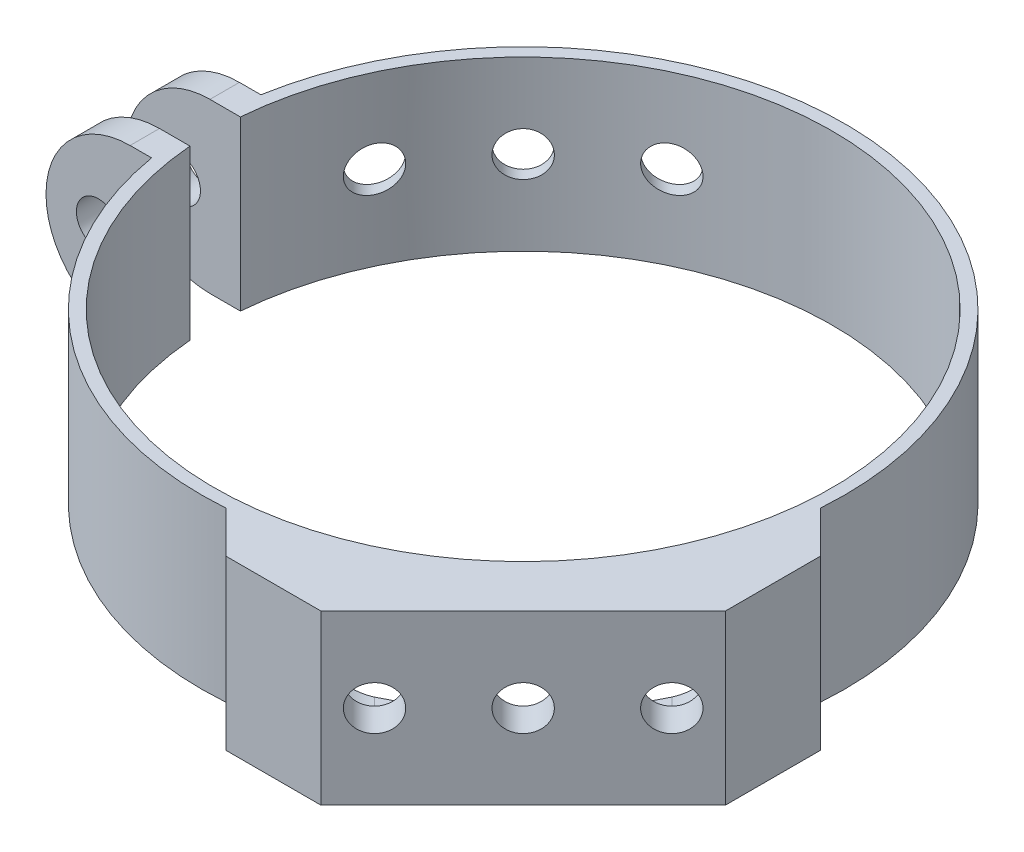
from build123d import *

# Parameters (mm, degrees)
BOSS_EXTRUDE1_DEPTH = 10
SKETCH2_R           = 2.625
CUT_EXTRUDE1_DEPTH  = 69.02664919
SKETCH3_R           = 2.625
CUT_EXTRUDE2_DEPTH  = 108.332520819
CUT_EXTRUDE3_DEPTH  = 11
FILLET1_R           = 10
CHAMFER1_SIZE       = 8


with BuildPart() as part:
    # Sketch1 → Boss-Extrude1 (new, symmetric)
    with BuildSketch(Plane(origin=(0, 0, 0), x_dir=(1, 0, 0), z_dir=(0, 1, 0))):
        with BuildLine():
            Line((-37.693666577, 6.5), (-50.25, 6.5))
            Line((-50.25, 6.5), (-50.25, 3))
            Line((-50.25, 3), (-36.627346341, 3))
            ThreePointArc((-36.627346341, 3), (3.731967617, 36.560018021), (36.478063401, -4.462442214))
            Line((36.478063401, -4.462442214), (38.147922337, -2.792583278))
            ThreePointArc((38.147922337, -2.792583278), (4.651839751, 37.966075474), (-37.693666577, 6.5))
        make_face()
        with BuildLine():
            Line((48.754524055, -13.399184996), (38.147922337, -2.792583278))
            ThreePointArc((38.147922337, -2.792583278), (27.04683438, -27.04683438), (2.792583278, -38.147922337))
            Line((2.792583278, -38.147922337), (13.399184996, -48.754524055))
            Line((13.399184996, -48.754524055), (48.754524055, -13.399184996))
        make_face()
        with BuildLine():
            ThreePointArc((-37.693666577, -6.5), (-23.55672199, -30.135416856), (2.792583278, -38.147922337))
            Line((2.792583278, -38.147922337), (4.462442214, -36.478063401))
            ThreePointArc((4.462442214, -36.478063401), (-23.212937054, -28.490736272), (-36.627346341, -3))
            Line((-36.627346341, -3), (-50.25, -3))
            Line((-50.25, -3), (-50.25, -6.5))
            Line((-50.25, -6.5), (-37.693666577, -6.5))
        make_face()
        with BuildLine():
            ThreePointArc((2.792583278, -38.147922337), (27.04683438, -27.04683438), (38.147922337, -2.792583278))
            Line((38.147922337, -2.792583278), (36.478063401, -4.462442214))
            ThreePointArc((36.478063401, -4.462442214), (25.986174209, -25.986174209), (4.462442214, -36.478063401))
            Line((4.462442214, -36.478063401), (2.792583278, -38.147922337))
        make_face()
    extrude(amount=BOSS_EXTRUDE1_DEPTH, both=True)

    # Sketch2 → Cut-Extrude1 (cut, through all)
    with BuildSketch(Plane.XY.offset(6.5)):
        with Locations((-44.008194531, 0)):
            Circle(SKETCH2_R)
    extrude(amount=-CUT_EXTRUDE1_DEPTH, mode=Mode.SUBTRACT)

    # Sketch3 → Cut-Extrude2 (cut, through all)
    with BuildSketch(Plane(origin=(31.076854525, 0, 31.076854525), x_dir=(0.7071067811865457, 0, -0.7071067811865496), z_dir=(0.7071067811865496, 0, 0.7071067811865457))):
        Circle(SKETCH3_R)
        with Locations((-12.5, 0)):
            Circle(SKETCH3_R)
        with Locations((12.5, 0)):
            Circle(SKETCH3_R)
    extrude(amount=-CUT_EXTRUDE2_DEPTH, mode=Mode.SUBTRACT)

    # Sketch6 → Cut-Extrude3 (cut)
    with BuildSketch(Plane(origin=(20.470252807, 0, 20.470252807), x_dir=(0.7071067811865457, 0, -0.7071067811865495), z_dir=(0.7071067811865495, 0, 0.7071067811865457))):
        with BuildLine():
            Line((12.5, -5.5), (-12.5, -5.5))
            ThreePointArc((-12.5, -5.5), (-18, 0), (-12.5, 5.5))
            Line((-12.5, 5.5), (12.5, 5.5))
            ThreePointArc((12.5, 5.5), (18, 0), (12.5, -5.5))
        make_face()
    extrude(amount=CUT_EXTRUDE3_DEPTH, mode=Mode.SUBTRACT)

    # Fillet1
    fillet1_edges = [part.edges().sort_by_distance(p)[0] for p in [
        (-50.25, -10, 4.75),
        (-50.25, 10, 4.75),
        (-50.25, -10, -4.75),
        (-50.25, 10, -4.75),
    ]]
    fillet(fillet1_edges, radius=FILLET1_R - 0.0001)  # a hair under: the kernel refuses the full size

    # Chamfer1
    chamfer1_edges = [part.edges().sort_by_distance(p)[0] for p in [
        (48.754524055, 0, 13.399184996),
        (13.399184996, 0, 48.754524055),
    ]]
    chamfer(chamfer1_edges, length=CHAMFER1_SIZE)


solid = part.part
